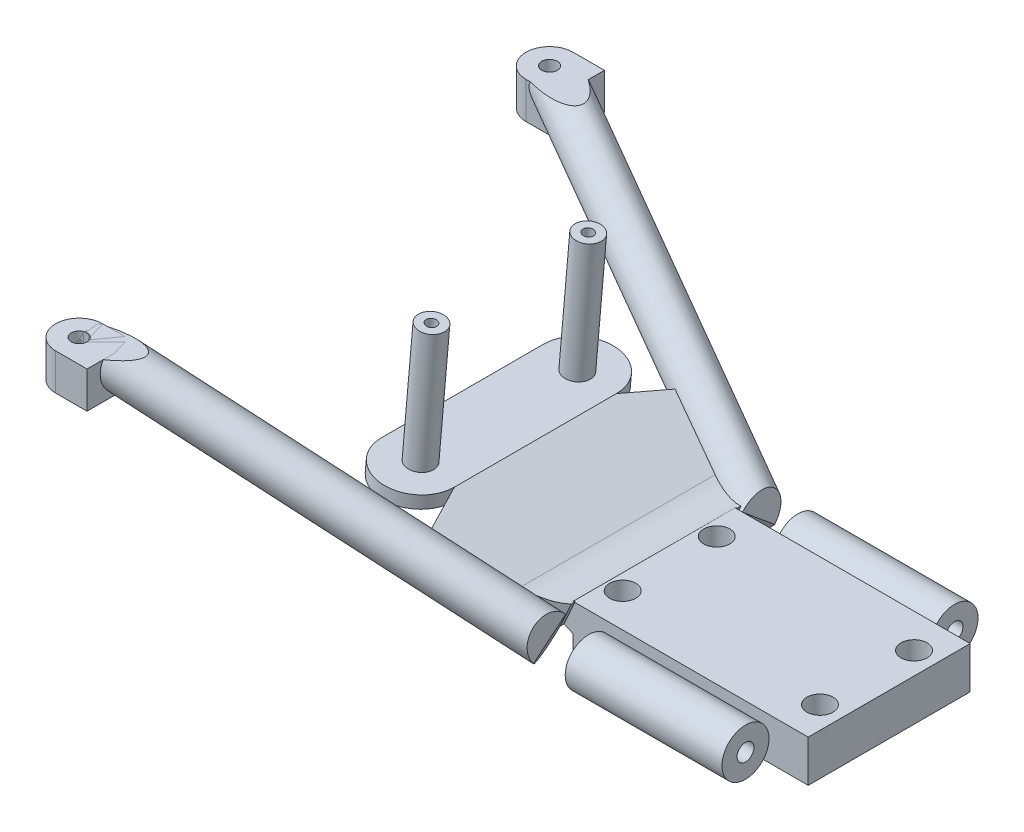
from build123d import *

# Parameters (mm, degrees)
SKETCH97_W                       = 45
SKETCH97_H                       = 31
BASE_DEPTH                       = 4
SKETCH98_R                       = 4.5
CYLINDERS_DEPTH                  = 45
CYLINDERS_2_DEPTH                = 45
ARM_1_PROFILE_R                  = 4
ARM_2_PROFILE_R                  = 4
ARM_PLATFORMS_DEPTH              = 7
POST_CONNECTOR_DEPTH             = 31
SKETCH128_R                      = 2.5
SKETCH128_R_2                    = 1
POSTS_DEPTH                      = 24
POST_PLATFORMS_DEPTH             = 2.5
SKETCH130_W                      = 16.362853456
SKETCH130_H                      = 6.736136134
ARM_TRIM_DEPTH                   = 99
SKETCH131_R                      = 1.5
ARM_HOLES_DEPTH                  = 93.036677509
SKETCH132_R                      = 1.625
SUSPENSION_ARM_ATTACHMENTS_DEPTH = 45
SKETCH134_W                      = 7.5
SKETCH134_H                      = 9
SUSPENSION_ARM_SLOTS_DEPTH       = 12.5
BOSS_EXTRUDE7_REACH              = 94.675
FILLET1_START                    = -18.604718507
FILLET1_DEPTH                    = 37.209437014
FILLET1_START_2                  = -15.5
FILLET1_2_DEPTH                  = 31
FILLET1_START_3                  = -17.995855857
FILLET1_3_DEPTH                  = 2.495855857
FILLET1_START_4                  = 15.5
FILLET1_4_DEPTH                  = 2.481792954
FILLET1_START_5                  = 1.25
FILLET1_5_DEPTH                  = 3.75
SKETCH137_R                      = 2.5
CUT_EXTRUDE6_DEPTH               = 8


with BuildPart() as part:
    # Sketch97 → Base (new, symmetric)
    with BuildSketch(Plane(origin=(0, 0, 0), x_dir=(1, 0, 0), z_dir=(0, 1, 0))):
        with Locations((22.5, 0)):
            Rectangle(SKETCH97_W, SKETCH97_H)
    extrude(amount=BASE_DEPTH, both=True)

    # Sketch127 → Post Connector (add)
    with BuildSketch(Plane(origin=(0, 0, -15.5), x_dir=(-1, 0, 0), z_dir=(0, 0, -1))):
        Polygon((0, -1.370297645), (23.346057588, 9.115643475), (36.653942412, 10.279932533), (36.653942412, 12.789482127), (22.707216639, 11.569301728), (0, 1.370297645), align=None)
    extrude(amount=-POST_CONNECTOR_DEPTH)

    # Sketch128 → Posts (add)
    # profile 1 of 2: a face of its own
    with BuildSketch(Plane(origin=(0.832007259, 9.509886489, 0), x_dir=(0.9961946980917455, -0.08715574274765821, 0), z_dir=(0.08715574274765821, 0.9961946980917455, 0))):
        with Locations(Location((-30.62913991, 15, 0), (0, 0, 11.536959033))):
            Circle(SKETCH128_R)
        with Locations(Location((-30.62913991, 15, 0), (0, 0, 30))):
            Circle(SKETCH128_R_2, mode=Mode.SUBTRACT)
    # profile 2 of 2: a face of its own
    with BuildSketch(Plane(origin=(0.832007259, 9.509886489, 0), x_dir=(0.9961946980917455, -0.08715574274765821, 0), z_dir=(0.08715574274765821, 0.9961946980917455, 0))):
        with Locations(Location((-30.62913991, -15, 0), (0, 0, 348.463040967))):
            Circle(SKETCH128_R)
        with Locations(Location((-30.62913991, -15, 0), (0, 0, 330))):
            Circle(SKETCH128_R_2, mode=Mode.SUBTRACT)
    extrude(amount=POSTS_DEPTH)

    # Sketch129 → Post Platforms (add)
    with BuildSketch(Plane(origin=(0.832007259, 9.509886489, 0), x_dir=(0.9961946980917455, -0.08715574274765821, 0), z_dir=(0.08715574274765821, 0.9961946980917455, 0))):
        with BuildLine():
            Line((-37.62913991, 15.5), (-23.62913991, 15.5))
            ThreePointArc((-23.62913991, 15.5), (-30.62913991, 22.5), (-37.62913991, 15.5))
        make_face()
        with BuildLine():
            Line((-37.62913991, -15.5), (-23.62913991, -15.5))
            ThreePointArc((-23.62913991, -15.5), (-30.62913991, -22.5), (-37.62913991, -15.5))
        make_face()
    extrude(amount=-POST_PLATFORMS_DEPTH)

    # Boss-Extrude7: up to this face of the body (flat: up to its plane)
    boss_extrude7_end = Plane(part.part.faces().sort_by_distance((-11.673028794, 3.872672915, 0))[0])
    # Sketch135 → Boss-Extrude7 (add, up to the picked face)
    with BuildSketch(Plane(origin=(0.512152123, 1.140263217, 0), x_dir=(0.9122105733011601, -0.40972169817763965, 0), z_dir=(0.40972169817763965, 0.9122105733011601, 0)), mode=Mode.PRIVATE) as boss_extrude7_sk1:
        Polygon((-25.453957059, 15.5), (-21.783782411, 23.370714932), (-1.318822801, 16.223664949), (-1.318822801, 15.5), align=None)
    boss_extrude7_tool1 = split(extrude(boss_extrude7_sk1.sketch, amount=-BOSS_EXTRUDE7_REACH, mode=Mode.PRIVATE), bisect_by=boss_extrude7_end, keep=Keep.BOTH, mode=Mode.PRIVATE)
    # Sketch135 → Boss-Extrude7 (add, up to the picked face)
    with BuildSketch(Plane(origin=(0.512152123, 1.140263217, 0), x_dir=(0.9122105733011601, -0.40972169817763965, 0), z_dir=(0.40972169817763965, 0.9122105733011601, 0)), mode=Mode.PRIVATE) as boss_extrude7_sk2:
        Polygon((-1.318822801, -15.5), (-25.453957059, -15.5), (-21.783782411, -23.370714932), (-1.318822801, -16.223664949), align=None)
    boss_extrude7_tool2 = split(extrude(boss_extrude7_sk2.sketch, amount=-BOSS_EXTRUDE7_REACH, mode=Mode.PRIVATE), bisect_by=boss_extrude7_end, keep=Keep.BOTH, mode=Mode.PRIVATE)
    add(boss_extrude7_tool1.solids().sort_by(Axis((-13.721683, 7.533427, -18.141018), (-0.40972169817763965, -0.9122105733011601, 0)))[0])
    add(boss_extrude7_tool2.solids().sort_by(Axis((-13.721683, 7.533427, 18.141018), (-0.40972169817763965, -0.9122105733011601, 0)))[0])

    # Fillet1: read off the stored shape, not the designer's step
    # Fillet1 outline → Fillet1 (add)
    with BuildSketch(Plane.XY.offset(FILLET1_START)):
        with BuildLine():
            Line((-6.910289561, 4.47407177), (-0.690891981, 1.680613535))
            Line((-0.690891981, 1.680613535), (0, 3.218825869))
            Line((0, 3.218825869), (0, 4))
            ThreePointArc((0, 4), (-3.497501335, 3.619627133), (-6.910289561, 4.47407177))
        make_face()
    extrude(amount=FILLET1_DEPTH)

    # Fillet1 2 outline → Fillet1 2 (add)
    with BuildSketch(Plane.XY.offset(FILLET1_START_2)):
        Polygon((0, 3.218825869), (-0.690891981, 1.680613535), (0, 1.370297645), align=None)
    extrude(amount=FILLET1_2_DEPTH)

    # Fillet1 3 outline → Fillet1 3 (add)
    with BuildSketch(Plane.XY.offset(FILLET1_START_3)):
        with BuildLine():
            Line((0, 4), (0, 3.218825869))
            Line((0, 3.218825869), (0.409029873, 4.129496152))
            ThreePointArc((0.409029873, 4.129496152), (0.205209503, 4.0625542), (0, 4))
        make_face()
    extrude(amount=FILLET1_3_DEPTH)

    # Fillet1 4 outline → Fillet1 4 (add)
    with BuildSketch(Plane.XY.offset(FILLET1_START_4)):
        with BuildLine():
            Line((0, 4), (0, 3.218825869))
            Line((0, 3.218825869), (0.409029873, 4.129496152))
            ThreePointArc((0.409029873, 4.129496152), (0.205209503, 4.0625542), (0, 4))
        make_face()
    extrude(amount=FILLET1_4_DEPTH)

    # Fillet1 5 outline → Fillet1 5 (cut)
    with BuildSketch(Plane(origin=(0, 0, 0), x_dir=(0.9122105733011605, -0.4097216981776387, 0), z_dir=(0.4097216981776387, 0.9122105733011606, 0)).offset(FILLET1_START_5)):
        Polygon((-8.136763516, 18.604718418), (-1.318822801, 16.223664949), (-1.318822802, 17.995855857), (-1.318822802, 18.604718507), align=None)
        Polygon((-1.318822801, -16.223664949), (-8.136763516, -18.604718418), (-1.318822801, -18.604718507), (-1.318822802, -17.981792954), align=None)
    extrude(amount=FILLET1_5_DEPTH, mode=Mode.SUBTRACT)

    # Sketch137 → Cut-Extrude6 (cut)
    with BuildSketch(Plane.XZ.offset(4)):
        with Locations(Location((3, 9, 0), (0, 0, 270))):
            Circle(SKETCH137_R)
        with Locations(Location((40.75, 9, 0), (0, 0, 270))):
            Circle(SKETCH137_R)
        with Locations(Location((40.75, -9, 0), (0, 0, 90))):
            Circle(SKETCH137_R)
        with Locations(Location((3, -9, 0), (0, 0, 90))):
            Circle(SKETCH137_R)
    extrude(amount=-CUT_EXTRUDE6_DEPTH, mode=Mode.SUBTRACT)


with BuildPart() as body_2:
    # Sketch98 → Cylinders (new body)
    with BuildSketch(Plane.ZY):
        with Locations((-20, 0)):
            Circle(SKETCH98_R)
    extrude(amount=-CYLINDERS_DEPTH)

    # Arm 2: sweep along a curve in space
    with BuildLine() as arm_2_path:
        Line((0, 0, -20), (-65, 30, -45))
    # Arm 2 profile (on start of the path) → Arm 2 (sweep)
    with BuildSketch(Plane(origin=(0, 0, -20), x_dir=(-0.41905817746174673, -0.9079593845004517, 0), z_dir=(-0.8571946154145232, 0.39562828403747213, -0.3296902366978935))):
        Circle(ARM_2_PROFILE_R)
    sweep(path=arm_2_path.line)

    # Sketch126 → Arm Platforms (add)
    with BuildSketch(Plane(origin=(0, 30, 0), x_dir=(1, 0, 0), z_dir=(0, 1, 0))):
        with BuildLine():
            Line((-59, -49.5), (-59, -40.5))
            Line((-59, -40.5), (-65, -40.5))
            ThreePointArc((-65, -40.5), (-69.5, -45), (-65, -49.5))
            Line((-65, -49.5), (-59, -49.5))
        make_face()
        with BuildLine():
            Line((-65, 49.5), (-59, 49.5))
            Line((-59, 49.5), (-59, 40.5))
            Line((-59, 40.5), (-65, 40.5))
            ThreePointArc((-65, 40.5), (-69.5, 45), (-65, 49.5))
        make_face()
    extrude(amount=-ARM_PLATFORMS_DEPTH)


with BuildPart() as body_3:
    # Sketch98 → Cylinders 2 (new body)
    with BuildSketch(Plane.ZY):
        with Locations((20, 0)):
            Circle(SKETCH98_R)
    extrude(amount=-CYLINDERS_2_DEPTH)

    # Arm 1: sweep along a curve in space
    with BuildLine() as arm_1_path:
        Line((0, 0, 20), (-65, 30, 45))
    # Arm 1 profile (on start of the path) → Arm 1 (sweep)
    with BuildSketch(Plane(origin=(0, 0, 20), x_dir=(-0.4190581774617468, -0.9079593845004517, 0), z_dir=(-0.8571946154145231, 0.39562828403747213, 0.32969023669789366))):
        Circle(ARM_1_PROFILE_R)
    sweep(path=arm_1_path.line)


with BuildPart() as arm_platforms_piece_1:
    # of the separate pieces the step leaves, piece 1, a body of its own (arm_platforms_pieces)
    add(body_2.part.solids().sort_by_distance((0, 0, -15.5))[0])


with BuildPart() as arm_platforms_piece_2:
    # of the separate pieces the step leaves, piece 2, a body of its own (arm_platforms_pieces)
    add(body_2.part.solids().sort_by_distance((-65, 30, 49.5))[0])


with BuildPart() as arm_trim_tool:
    # Sketch130 → Arm Trim (new body)
    with BuildSketch(Plane(origin=(0, 0, -49.5), x_dir=(-1, 0, 0), z_dir=(0, 0, -1))):
        with Locations((61.734530152, 33.368068067)):
            Rectangle(SKETCH130_W, SKETCH130_H)
    extrude(amount=-ARM_TRIM_DEPTH)


with BuildPart() as body_3_1:
    add(body_3.part)

    # Arm Trim: cut by arm_trim_tool
    add(arm_trim_tool.part, mode=Mode.SUBTRACT)


with BuildPart() as arm_platforms_piece_1_1:
    add(arm_platforms_piece_1.part)

    # Arm Trim: cut by arm_trim_tool
    add(arm_trim_tool.part, mode=Mode.SUBTRACT)


with BuildPart() as arm_holes_tool:
    # Sketch131 → Arm holes (new, through all)
    with BuildSketch(Plane(origin=(0, 30, 0), x_dir=(1, 0, 0), z_dir=(0, 1, 0))):
        with Locations(Location((-65, 45, 0), (0, 0, 270))):
            Circle(SKETCH131_R)
        with Locations(Location((-65, -45, 0), (0, 0, 90))):
            Circle(SKETCH131_R)
    extrude(amount=-ARM_HOLES_DEPTH)


with BuildPart() as body_3_2:
    add(body_3_1.part)

    # Arm holes: cut by arm_holes_tool
    add(arm_holes_tool.part, mode=Mode.SUBTRACT)


with BuildPart() as arm_platforms_piece_1_2:
    add(arm_platforms_piece_1_1.part)

    # Arm holes: cut by arm_holes_tool
    add(arm_holes_tool.part, mode=Mode.SUBTRACT)


with BuildPart() as arm_platforms_piece_2_1:
    add(arm_platforms_piece_2.part)

    # Arm holes: cut by arm_holes_tool
    add(arm_holes_tool.part, mode=Mode.SUBTRACT)


with BuildPart() as suspension_arm_attachments_tool:
    # Sketch132 → Suspension Arm Attachments (new body)
    with BuildSketch(Plane(origin=(45, 0, 0), x_dir=(0, 0, -1), z_dir=(1, 0, 0))):
        with Locations((-20, 0)):
            Circle(SKETCH132_R)
        with Locations((20, 0)):
            Circle(SKETCH132_R)
    extrude(amount=-SUSPENSION_ARM_ATTACHMENTS_DEPTH)


with BuildPart() as body_3_3:
    add(body_3_2.part)

    # Suspension Arm Attachments: cut by suspension_arm_attachments_tool
    add(suspension_arm_attachments_tool.part, mode=Mode.SUBTRACT)


with BuildPart() as arm_platforms_piece_1_3:
    add(arm_platforms_piece_1_2.part)

    # Suspension Arm Attachments: cut by suspension_arm_attachments_tool
    add(suspension_arm_attachments_tool.part, mode=Mode.SUBTRACT)


with BuildPart() as suspension_arm_slots_tool:
    # Sketch134 → Suspension Arm slots (new, symmetric)
    with BuildSketch(Plane(origin=(0, 4, 0), x_dir=(1, 0, 0), z_dir=(0, 1, 0))):
        with Locations((3.75, 20)):
            Rectangle(SKETCH134_W, SKETCH134_H)
        with Locations((41.25, 20)):
            Rectangle(SKETCH134_W, SKETCH134_H)
        with Locations((41.25, -20)):
            Rectangle(SKETCH134_W, SKETCH134_H)
        with Locations((3.75, -20)):
            Rectangle(SKETCH134_W, SKETCH134_H)
    extrude(amount=SUSPENSION_ARM_SLOTS_DEPTH, both=True)


with BuildPart() as body_3_4:
    add(body_3_3.part)

    # Suspension Arm slots: cut by suspension_arm_slots_tool
    add(suspension_arm_slots_tool.part, mode=Mode.SUBTRACT)


with BuildPart() as arm_platforms_piece_1_4:
    add(arm_platforms_piece_1_3.part)

    # Suspension Arm slots: cut by suspension_arm_slots_tool
    add(suspension_arm_slots_tool.part, mode=Mode.SUBTRACT)


with BuildPart() as suspension_arm_slots_piece_1:
    # of the separate pieces the step leaves, piece 1, a body of its own (suspension_arm_slots_pieces)
    add(body_3_4.part.solids().sort_by_distance((0, -2.560737599, 23.072885118))[0])


with BuildPart() as suspension_arm_slots_piece_2:
    # of the separate pieces the step leaves, piece 2, a body of its own (suspension_arm_slots_pieces)
    add(body_3_4.part.solids().sort_by_distance((7.5, 0, 24.5))[0])


with BuildPart() as suspension_arm_slots_piece_1_of_arm_plat:
    # of the separate pieces the step leaves, piece 1, a body of its own (suspension_arm_slots_pieces_of_arm_platf)
    add(arm_platforms_piece_1_4.part.solids().sort_by_distance((0, 2.560737599, -16.927114882))[0])


with BuildPart() as suspension_arm_slots_piece_2_of_arm_plat:
    # of the separate pieces the step leaves, piece 2, a body of its own (suspension_arm_slots_pieces_of_arm_platf)
    add(arm_platforms_piece_1_4.part.solids().sort_by_distance((7.5, 0, -15.5))[0])


solid = Compound([part.part, arm_platforms_piece_2_1.part, suspension_arm_slots_piece_1.part, suspension_arm_slots_piece_2.part, suspension_arm_slots_piece_1_of_arm_plat.part, suspension_arm_slots_piece_2_of_arm_plat.part])
